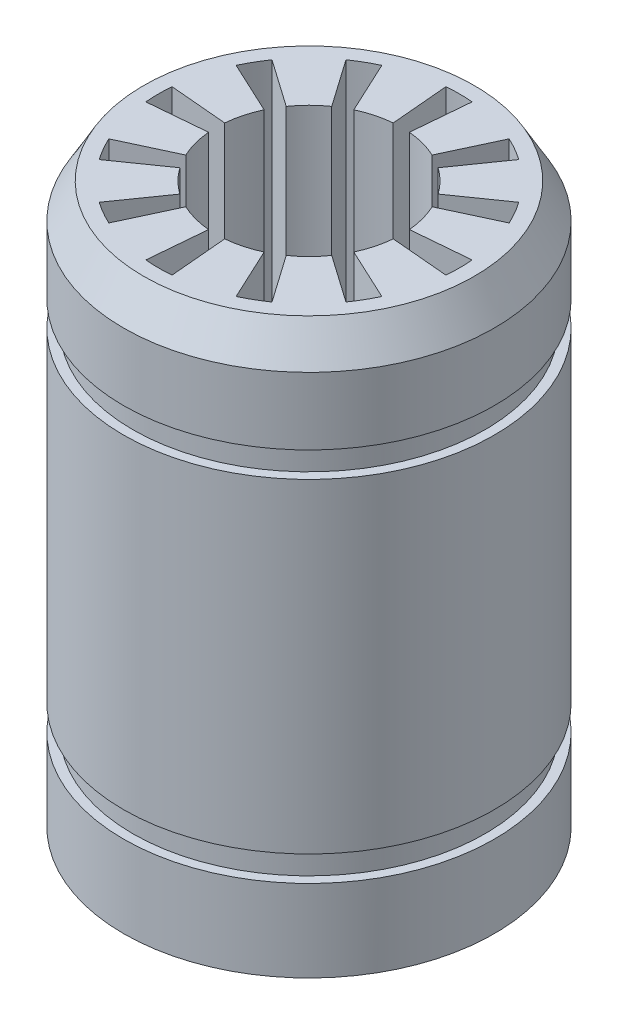
from build123d import *
from OCP.BRepFilletAPI import BRepFilletAPI_MakeChamfer

# Parameters (mm, degrees)
CUT_EXTRUDE1_DEPTH = 28.440845468
CHAMFER1_SIZE      = 0.866025404
CHAMFER1_SIZE_2    = 1.5


with BuildPart() as part:
    # Sketch1 → Revolve1 (revolve)
    with BuildSketch(Plane(origin=(0, 0, 0), x_dir=(-1, 0, 0), z_dir=(0, 0, -1)), mode=Mode.PRIVATE) as revolve1_sk:
        Polygon((-8, -12.5), (0, -12.5), (0, 12.5), (-8, 12.5), (-8, 8.1), (-7.6, 8.1), (-7.6, 7), (-8, 7), (-8, -7), (-7.6, -7), (-7.6, -8.1), (-8, -8.1), align=None)
    revolve(revolve1_sk.sketch.rotate(Axis((0, -12.5, 0), (0, 1, 0)), 270), axis=Axis((0, -12.5, 0), (0, 1, 0)))

    # Sketch2 → Cut-Extrude1 (cut, through all)
    with BuildSketch(Plane.XZ.offset(12.5)):
        with BuildLine():
            Line((-1.690473047, 3.625231148), (-2.747018701, 5.891000616))
            ThreePointArc((-2.747018701, 5.891000616), (-3.25, 5.629165125), (-3.728246836, 5.324488288))
            Line((-3.728246836, 5.324488288), (-2.294305745, 3.276608177))
            ThreePointArc((-2.294305745, 3.276608177), (-2.828427125, 2.828427125), (-3.276608177, 2.294305745))
            Line((-3.276608177, 2.294305745), (-5.324488288, 3.728246836))
            ThreePointArc((-5.324488288, 3.728246836), (-5.629165125, 3.25), (-5.891000616, 2.747018701))
            Line((-5.891000616, 2.747018701), (-3.625231148, 1.690473047))
            ThreePointArc((-3.625231148, 1.690473047), (-3.863703305, 1.03527618), (-3.984778792, 0.348622971))
            Line((-3.984778792, 0.348622971), (-6.475265538, 0.566512328))
            ThreePointArc((-6.475265538, 0.566512328), (-6.5, 0), (-6.475265538, -0.566512328))
            Line((-6.475265538, -0.566512328), (-3.984778792, -0.348622971))
            ThreePointArc((-3.984778792, -0.348622971), (-3.863703305, -1.03527618), (-3.625231148, -1.690473047))
            Line((-3.625231148, -1.690473047), (-5.891000616, -2.747018701))
            ThreePointArc((-5.891000616, -2.747018701), (-5.629165125, -3.25), (-5.324488288, -3.728246836))
            Line((-5.324488288, -3.728246836), (-3.276608177, -2.294305745))
            ThreePointArc((-3.276608177, -2.294305745), (-2.828427125, -2.828427125), (-2.294305745, -3.276608177))
            Line((-2.294305745, -3.276608177), (-3.728246836, -5.324488288))
            ThreePointArc((-3.728246836, -5.324488288), (-3.25, -5.629165125), (-2.747018701, -5.891000616))
            Line((-2.747018701, -5.891000616), (-1.690473047, -3.625231148))
            ThreePointArc((-1.690473047, -3.625231148), (-1.03527618, -3.863703305), (-0.348622971, -3.984778792))
            Line((-0.348622971, -3.984778792), (-0.566512328, -6.475265538))
            ThreePointArc((-0.566512328, -6.475265538), (0, -6.5), (0.566512328, -6.475265538))
            Line((0.566512328, -6.475265538), (0.348622971, -3.984778792))
            ThreePointArc((0.348622971, -3.984778792), (1.03527618, -3.863703305), (1.690473047, -3.625231148))
            Line((1.690473047, -3.625231148), (2.747018701, -5.891000616))
            ThreePointArc((2.747018701, -5.891000616), (3.25, -5.629165125), (3.728246836, -5.324488288))
            Line((3.728246836, -5.324488288), (2.294305745, -3.276608177))
            ThreePointArc((2.294305745, -3.276608177), (2.828427125, -2.828427125), (3.276608177, -2.294305745))
            Line((3.276608177, -2.294305745), (5.324488288, -3.728246836))
            ThreePointArc((5.324488288, -3.728246836), (5.629165125, -3.25), (5.891000616, -2.747018701))
            Line((5.891000616, -2.747018701), (3.625231148, -1.690473047))
            ThreePointArc((3.625231148, -1.690473047), (3.863703305, -1.03527618), (3.984778792, -0.348622971))
            Line((3.984778792, -0.348622971), (6.475265538, -0.566512328))
            ThreePointArc((6.475265538, -0.566512328), (6.5, 0), (6.475265538, 0.566512328))
            Line((6.475265538, 0.566512328), (3.984778792, 0.348622971))
            ThreePointArc((3.984778792, 0.348622971), (3.863703305, 1.03527618), (3.625231148, 1.690473047))
            Line((3.625231148, 1.690473047), (5.891000616, 2.747018701))
            ThreePointArc((5.891000616, 2.747018701), (5.629165125, 3.25), (5.324488288, 3.728246836))
            Line((5.324488288, 3.728246836), (3.276608177, 2.294305745))
            ThreePointArc((3.276608177, 2.294305745), (2.828427125, 2.828427125), (2.294305745, 3.276608177))
            Line((2.294305745, 3.276608177), (3.728246836, 5.324488288))
            ThreePointArc((3.728246836, 5.324488288), (3.25, 5.629165125), (2.747018701, 5.891000616))
            Line((2.747018701, 5.891000616), (1.690473047, 3.625231148))
            ThreePointArc((1.690473047, 3.625231148), (1.03527618, 3.863703305), (0.348622971, 3.984778792))
            Line((0.348622971, 3.984778792), (0.566512328, 6.475265538))
            ThreePointArc((0.566512328, 6.475265538), (0, 6.5), (-0.566512328, 6.475265538))
            Line((-0.566512328, 6.475265538), (-0.348622971, 3.984778792))
            ThreePointArc((-0.348622971, 3.984778792), (-1.03527618, 3.863703305), (-1.690473047, 3.625231148))
        make_face()
    extrude(amount=-CUT_EXTRUDE1_DEPTH, mode=Mode.SUBTRACT)

    # Chamfer1
    chamfer1_edges_1 = [part.edges().sort_by_distance(p)[0] for p in [
        (0, 12.5, -8),
    ]]
    chamfer1_side_1 = [part.faces().sort_by_distance(p)[0] for p in [
        (0, 12.5, -7.982679492),
    ]]
    chamfer1_edges_2 = [part.edges().sort_by_distance(p)[0] for p in [
        (0, -12.5, -8),
    ]]
    chamfer1_side_2 = [part.faces().sort_by_distance(p)[0] for p in [
        (0, -12.5, -7.982679492),
    ]]
    chamfer1 = BRepFilletAPI_MakeChamfer(part.part.solid().wrapped)
    for e in chamfer1_edges_1:
        chamfer1.Add(CHAMFER1_SIZE - 0.0001, CHAMFER1_SIZE_2 - 0.0001, e.wrapped, chamfer1_side_1[0].wrapped)
    for e in chamfer1_edges_2:
        chamfer1.Add(CHAMFER1_SIZE_2 - 0.0001, CHAMFER1_SIZE - 0.0001, e.wrapped, chamfer1_side_2[0].wrapped)
    add(Compound.cast(chamfer1.Shape()), mode=Mode.REPLACE)  # a hair under: the kernel refuses the full size


solid = part.part
